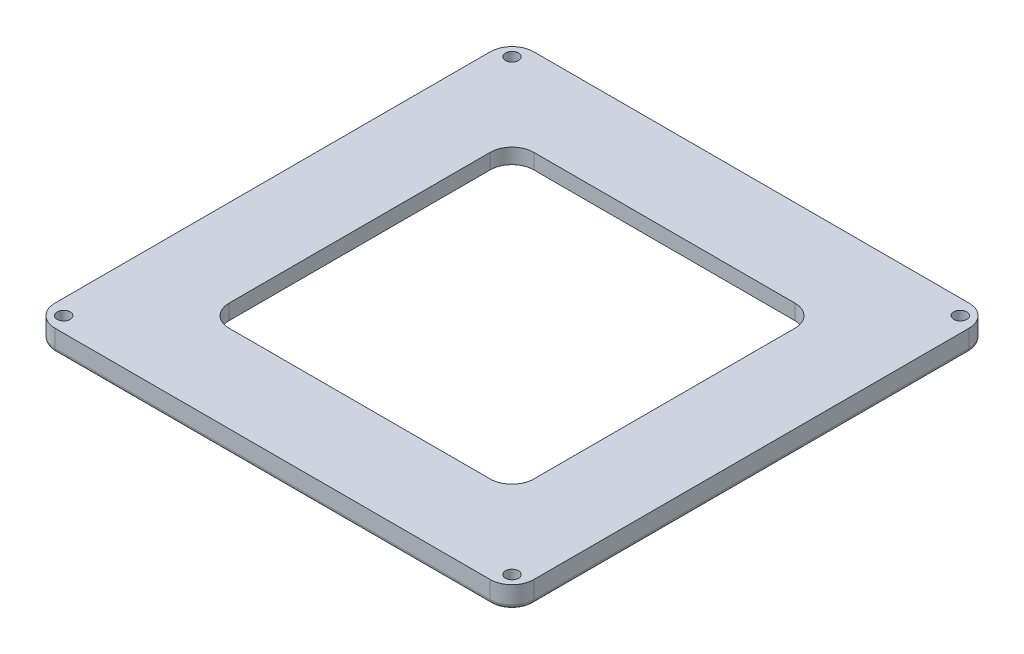
from build123d import *

# Parameters (mm, degrees)
SKETCH1_W                     = 220
SKETCH1_H                     = 220
BOSS_EXTRUDE1_DEPTH           = 10
FILLET1_R                     = 10
F_6_0MM_START                 = 2
F_6_0MM_DOWEL_HOLE1_OUTLINE_R = 3
F_6_0MM_DOWEL_HOLE1_DEPTH     = 8
F_6_0MM_DOWEL_HOLE2_OUTLINE_R = 3
F_6_0MM_DOWEL_HOLE2_DEPTH     = 8
SKETCH6_R                     = 40
CUT_EXTRUDE1_DEPTH            = 156.884572681
SKETCH7_W                     = 180
SKETCH7_H                     = 180
CUT_EXTRUDE2_DEPTH            = 3
SKETCH8_W                     = 140
SKETCH8_H                     = 140
CUT_EXTRUDE3_DEPTH            = 156.720904184
FILLET3_R                     = 10
FILLET4_R                     = 2


# Read off the part's stored shape, not the designer's step: Ø6.0mm Dowel Hole1, Ø6.0mm Dowel Hole2
with BuildPart() as part:
    # Sketch1 → Boss-Extrude1 (new body)
    with BuildSketch(Plane(origin=(0, 0, 0), x_dir=(1, 0, 0), z_dir=(0, 1, 0))):
        Rectangle(SKETCH1_W, SKETCH1_H)
    extrude(amount=BOSS_EXTRUDE1_DEPTH)

    # Fillet1
    fillet1_edges = [part.edges().sort_by_distance(p)[0] for p in [
        (110, 5, 110),
        (-110, 5, 110),
        (-110, 5, -110),
        (110, 5, -110),
    ]]
    fillet(fillet1_edges, radius=FILLET1_R)

    # Ø6.0mm Dowel Hole1 outline → Ø6.0mm Dowel Hole1 (cut)
    with BuildSketch(Plane(origin=(0, 0, 0), x_dir=(1, 0, 0), z_dir=(0, 1, 0)).offset(F_6_0MM_START)):
        with Locations((-103, -103)):
            Circle(F_6_0MM_DOWEL_HOLE1_OUTLINE_R)
        with Locations((103, 103)):
            Circle(F_6_0MM_DOWEL_HOLE1_OUTLINE_R)
        with Locations((103, -103)):
            Circle(F_6_0MM_DOWEL_HOLE1_OUTLINE_R)
        with Locations((-103, 103)):
            Circle(F_6_0MM_DOWEL_HOLE1_OUTLINE_R)
        Circle(F_6_0MM_DOWEL_HOLE1_OUTLINE_R)
    extrude(amount=F_6_0MM_DOWEL_HOLE1_DEPTH, mode=Mode.SUBTRACT)

    # Ø6.0mm Dowel Hole2 outline → Ø6.0mm Dowel Hole2 (cut)
    with BuildSketch(Plane(origin=(0, 0, 0), x_dir=(1, 0, 0), z_dir=(0, 1, 0))):
        Circle(F_6_0MM_DOWEL_HOLE2_OUTLINE_R)
        with Locations((0, -80)):
            Circle(F_6_0MM_DOWEL_HOLE2_OUTLINE_R)
        with Locations((80, 0)):
            Circle(F_6_0MM_DOWEL_HOLE2_OUTLINE_R)
        with Locations((0, 80)):
            Circle(F_6_0MM_DOWEL_HOLE2_OUTLINE_R)
        with Locations((-80, 0)):
            Circle(F_6_0MM_DOWEL_HOLE2_OUTLINE_R)
        with Locations((80, 80)):
            Circle(F_6_0MM_DOWEL_HOLE2_OUTLINE_R)
        with Locations((-80, -80)):
            Circle(F_6_0MM_DOWEL_HOLE2_OUTLINE_R)
        with Locations((-80, 80)):
            Circle(F_6_0MM_DOWEL_HOLE2_OUTLINE_R)
        with Locations((80, -80)):
            Circle(F_6_0MM_DOWEL_HOLE2_OUTLINE_R)
    extrude(amount=F_6_0MM_DOWEL_HOLE2_DEPTH, mode=Mode.SUBTRACT)

    # Sketch6 → Cut-Extrude1 (cut, through all)
    with BuildSketch(Plane(origin=(0, 10, 0), x_dir=(1, 0, 0), z_dir=(0, 1, 0))):
        with Locations(Location((0, 0, 0), (0, 0, 270))):
            Circle(SKETCH6_R)
    extrude(amount=-CUT_EXTRUDE1_DEPTH, mode=Mode.SUBTRACT)

    # Sketch7 → Cut-Extrude2 (cut)
    with BuildSketch(Plane.XZ):
        Rectangle(SKETCH7_W, SKETCH7_H)
    extrude(amount=-CUT_EXTRUDE2_DEPTH, mode=Mode.SUBTRACT)

    # Sketch8 → Cut-Extrude3 (cut, through all)
    with BuildSketch(Plane.XZ.offset(-3)):
        Rectangle(SKETCH8_W, SKETCH8_H)
    extrude(amount=-CUT_EXTRUDE3_DEPTH, mode=Mode.SUBTRACT)

    # Fillet3
    fillet3_edges = [part.edges().sort_by_distance(p)[0] for p in [
        (90, 1.5, 90),
        (90, 1.5, -90),
        (-90, 1.5, -90),
        (-90, 1.5, 90),
        (-70, 6.5, -70),
        (-70, 6.5, 70),
        (70, 6.5, 70),
        (70, 6.5, -70),
    ]]
    fillet(fillet3_edges, radius=FILLET3_R)

    # Fillet4
    fillet4_edges = [part.edges().sort_by_distance(p)[0] for p in [
        (0, 0, 110),
        (110, 0, 0),
        (-110, 0, 0),
        (0, 0, -110),
        (-107.071067812, 0, -107.071067812),
        (107.071067812, 0, -107.071067812),
        (107.071067812, 0, 107.071067812),
        (-107.071067812, 0, 107.071067812),
    ]]
    fillet(fillet4_edges, radius=FILLET4_R)


solid = part.part
